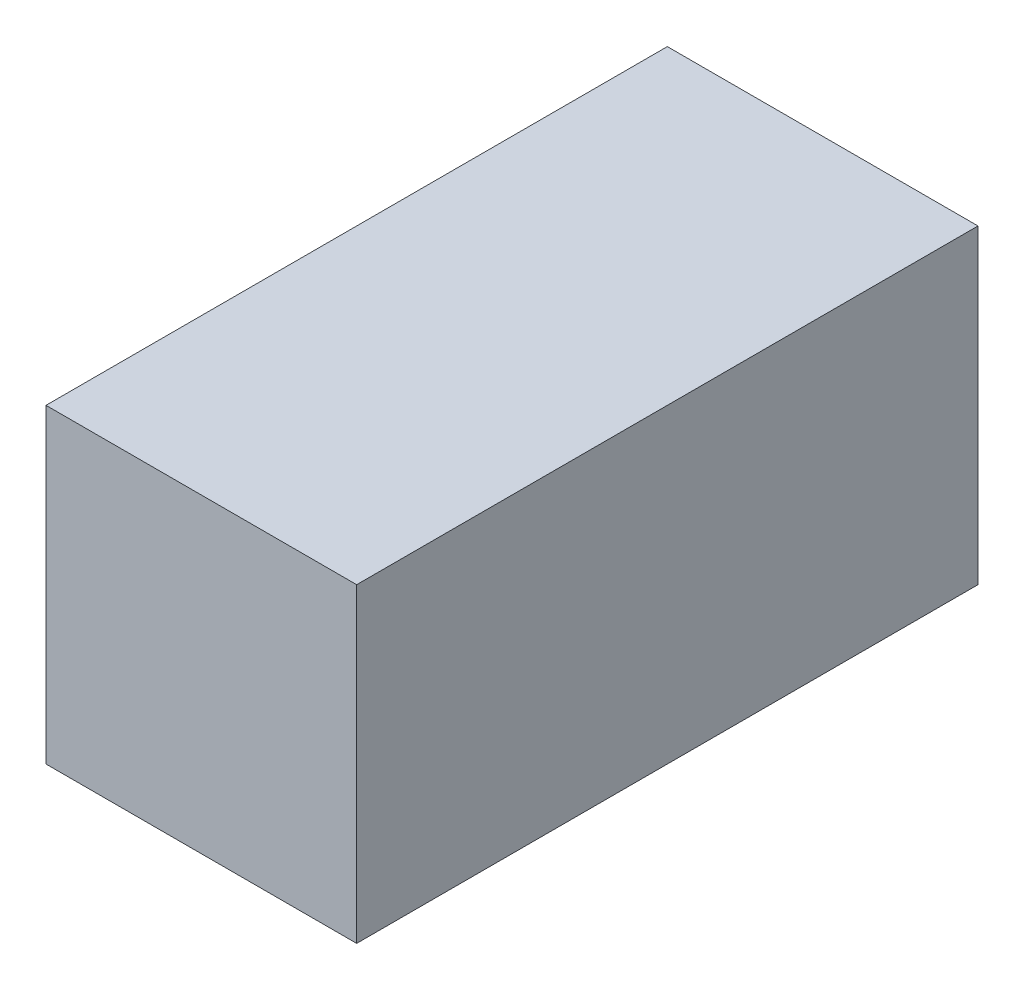
from build123d import *

# Parameters (mm, degrees)
SKETCH1_W           = 76.2
SKETCH1_H           = 76.2
BOSS_EXTRUDE1_DEPTH = 152.4


with BuildPart() as part:
    # Sketch1 → Boss-Extrude1 (new body)
    with BuildSketch(Plane.XY):
        with Locations((38.1, 38.1)):
            Rectangle(SKETCH1_W, SKETCH1_H)
    extrude(amount=BOSS_EXTRUDE1_DEPTH)


solid = part.part
